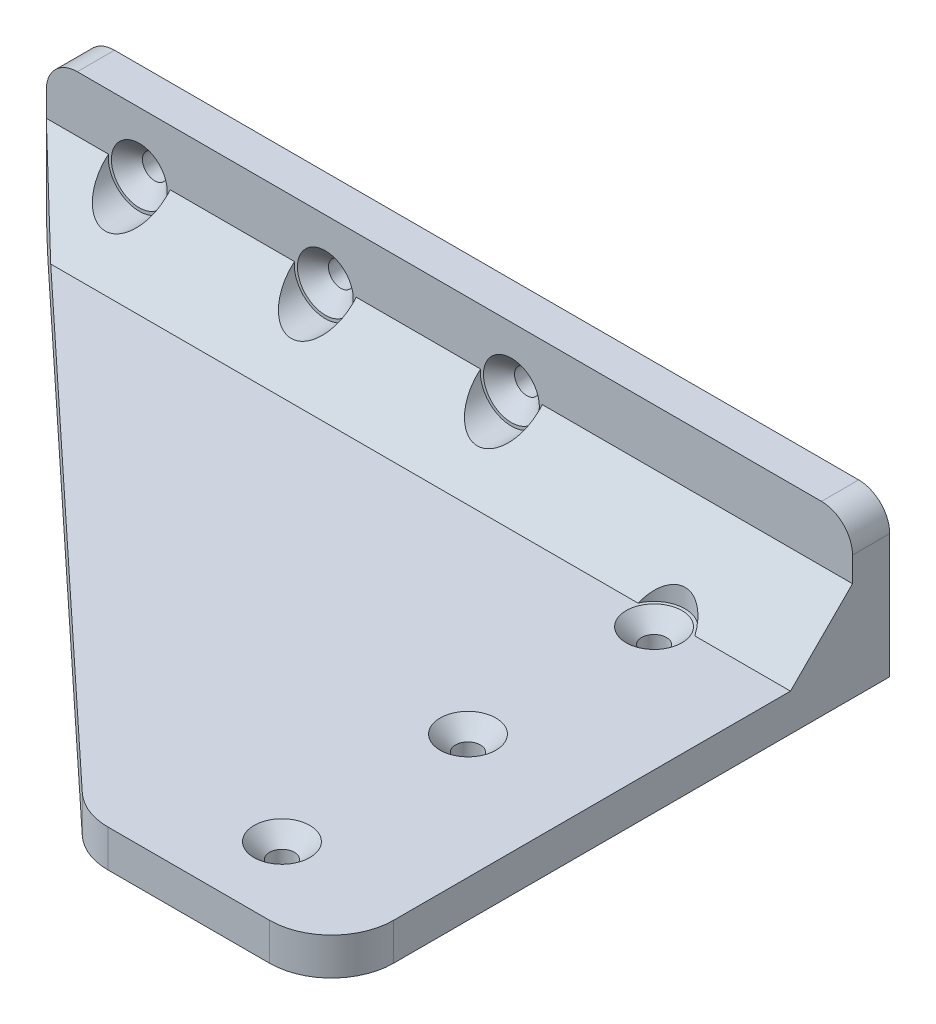
from build123d import *

# Parameters (mm, degrees)
ESQUISSE1_W                  = 90
ESQUISSE1_H                  = 25
BOSS_EXTRU_1_DEPTH           = 6
ESQUISSE2_W                  = 90
ESQUISSE2_H                  = 6
BOSS_EXTRU_2_DEPTH           = 40
ESQUISSE3_W                  = 40
ESQUISSE3_H                  = 6
BOSS_EXTRU_3_DEPTH           = 19
BOSS_EXTRU_4_DEPTH           = 6
ESQUISSE5_R                  = 2
ENL_V_MAT_EXTRU_1_DEPTH      = 157.783289926
ENL_V_MAT_EXTRU_2_DEPTH      = 160.25137362
ENL_V_MAT_EXTRU_2_DEPTH_BACK = 160.25137362
ESQUISSE6_R                  = 2
CHANFREIN1_SIZE              = 10
ESQUISSE7_R                  = 5
ENL_V_MAT_EXTRU_3_DEPTH      = 157.783289926
ESQUISSE8_R                  = 5
ENL_V_MAT_EXTRU_4_DEPTH      = 160.25137362
CHANFREIN3_SIZE              = 2.5
CONG_1_R                     = 10
CONG_2_R                     = 5


with BuildPart() as part:
    # Esquisse1 → Boss.-Extru.1 (new body)
    with BuildSketch(Plane.XY):
        with Locations((45, 12.5)):
            Rectangle(ESQUISSE1_W, ESQUISSE1_H)
    extrude(amount=BOSS_EXTRU_1_DEPTH)

    # Esquisse2 → Boss.-Extru.2 (add)
    with BuildSketch(Plane(origin=(90, 0, 0), x_dir=(0, 0, -1), z_dir=(1, 0, 0))):
        with Locations((-45, 3)):
            Rectangle(ESQUISSE2_W, ESQUISSE2_H)
    extrude(amount=BOSS_EXTRU_2_DEPTH)

    # Esquisse3 → Boss.-Extru.3 (add)
    with BuildSketch(Plane(origin=(0, 6, 0), x_dir=(1, 0, 0), z_dir=(0, 1, 0))):
        with Locations((110, -3)):
            Rectangle(ESQUISSE3_W, ESQUISSE3_H)
    extrude(amount=BOSS_EXTRU_3_DEPTH)

    # Esquisse4 → Boss.-Extru.4 (add)
    with BuildSketch(Plane.XZ):
        Polygon((0, 6), (90, 90), (90, 6), align=None)
    extrude(amount=-BOSS_EXTRU_4_DEPTH)

    # Esquisse5 → Enlèv. mat.-Extru.1 (cut, through all)
    with BuildSketch(Plane.XY.offset(6)):
        with Locations((45, 15.5)):
            Circle(ESQUISSE5_R)
        with Locations((15, 15.5)):
            Circle(ESQUISSE5_R)
        with Locations(Location((75, 15.5, 0), (0, 0, 180))):
            Circle(ESQUISSE5_R)
    extrude(amount=-ENL_V_MAT_EXTRU_1_DEPTH, mode=Mode.SUBTRACT)

    # Esquisse6 → Enlèv. mat.-Extru.2 (cut, two sides: drawn at the far end of the back side and taken through both)
    with BuildSketch(Plane(origin=(0, 6, 0), x_dir=(1, 0, 0), z_dir=(0, 1, 0)).offset(-ENL_V_MAT_EXTRU_2_DEPTH_BACK)):
        with Locations(Location((110, -48, 0), (0, 0, 270))):
            Circle(ESQUISSE6_R)
        with Locations(Location((110, -18, 0), (0, 0, 270))):
            Circle(ESQUISSE6_R)
        with Locations(Location((110, -78, 0), (0, 0, 90))):
            Circle(ESQUISSE6_R)
    extrude(amount=ENL_V_MAT_EXTRU_2_DEPTH + ENL_V_MAT_EXTRU_2_DEPTH_BACK, mode=Mode.SUBTRACT)

    # Chanfrein1
    # the kernel refuses this chamfer: 10 mm, written as the material it adds along each edge
    with BuildSketch(Plane(origin=(0, 6, 6), x_dir=(0, 0.9996219169112968, -0.027495876610586403), z_dir=(1, 0, 0))) as chanfrein1_piece_1_section:
        Polygon((CHANFREIN1_SIZE * 0.999621916911, CHANFREIN1_SIZE * 0.0274958766106), (-CHANFREIN1_SIZE * 0.0274958766106, CHANFREIN1_SIZE * 0.999621916911), (0, 0), align=None)
    chanfrein1_piece_1 = extrude(amount=130, mode=Mode.PRIVATE)
    chanfrein1_piece_1 = split(chanfrein1_piece_1, bisect_by=Plane(origin=(37.357692618, 9.297592043, 40.867179777), z_dir=(0.6823182503600111, 0, -0.7310552682428691)), keep=Keep.TOP, mode=Mode.PRIVATE)
    chanfrein1_piece_1 = chanfrein1_piece_1 - Plane(origin=(110, 9.297592043, 18), x_dir=(0, 0, 1), z_dir=(0, 1, 0)) * Cylinder(2, 300, mode=Mode.PRIVATE)
    chanfrein1_piece_1 = chanfrein1_piece_1 - Plane(origin=(15, 15.5, 9.259179561), x_dir=(1, 0, 0), z_dir=(0, 0, 1)) * Cylinder(2, 300, mode=Mode.PRIVATE)
    chanfrein1_piece_1 = chanfrein1_piece_1 - Plane(origin=(45, 15.5, 9.259179561), x_dir=(1, 0, 0), z_dir=(0, 0, 1)) * Cylinder(2, 300, mode=Mode.PRIVATE)
    chanfrein1_piece_1 = chanfrein1_piece_1 - Plane(origin=(75, 15.5, 9.259179561), x_dir=(-1, 0, 0), z_dir=(0, 0, 1)) * Cylinder(2, 300, mode=Mode.PRIVATE)
    add(chanfrein1_piece_1)

    # Esquisse7 → Enlèv. mat.-Extru.3 (cut, through all)
    with BuildSketch(Plane.XY.offset(6)):
        with Locations((45, 15.5)):
            Circle(ESQUISSE7_R)
        with Locations((15, 15.5)):
            Circle(ESQUISSE7_R)
        with Locations((75, 15.5)):
            Circle(ESQUISSE7_R)
    extrude(amount=ENL_V_MAT_EXTRU_3_DEPTH, mode=Mode.SUBTRACT)

    # Esquisse8 → Enlèv. mat.-Extru.4 (cut, through all)
    with BuildSketch(Plane(origin=(0, 6, 0), x_dir=(1, 0, 0), z_dir=(0, 1, 0))):
        with Locations((110, -18)):
            Circle(ESQUISSE8_R)
    extrude(amount=ENL_V_MAT_EXTRU_4_DEPTH, mode=Mode.SUBTRACT)

    # Chanfrein3
    chanfrein3_edges = [part.edges().sort_by_distance(p)[0] for p in [
        (43, 15.5, 6),
        (13, 15.5, 6),
        (77, 15.5, 6),
        (110, 6, 46),
        (110, 6, 16),
        (110, 6, 80),
    ]]
    chamfer(chanfrein3_edges, length=CHANFREIN3_SIZE)

    # Congé1
    cong_1_edges = [part.edges().sort_by_distance(p)[0] for p in [
        (90, 3, 90),
        (130, 3, 90),
    ]]
    fillet(cong_1_edges, radius=CONG_1_R)

    # Congé2
    cong_2_edges = [part.edges().sort_by_distance(p)[0] for p in [
        (130, 25, 3),
        (0, 25, 3),
        (0, 0, 3),
    ]]
    fillet(cong_2_edges, radius=CONG_2_R)


solid = part.part
